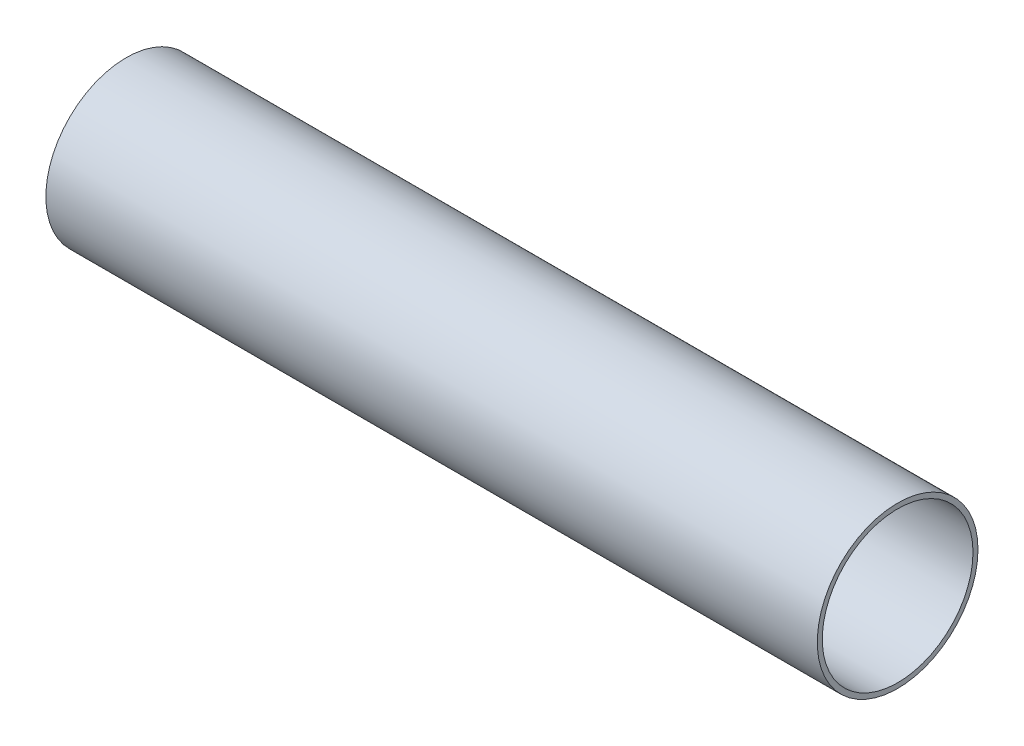
from build123d import *

# Parameters (mm, degrees)
SKETCH1_R           = 14.2875
SKETCH1_R_2         = 13.3985
BOSS_EXTRUDE1_DEPTH = 68.58


with BuildPart() as part:
    # Sketch1 → Boss-Extrude1 (new, symmetric)
    with BuildSketch(Plane(origin=(0, 0, 0), x_dir=(0, 0, -1), z_dir=(1, 0, 0))):
        Circle(SKETCH1_R)
        Circle(SKETCH1_R_2, mode=Mode.SUBTRACT)
    extrude(amount=BOSS_EXTRUDE1_DEPTH, both=True)


solid = part.part
